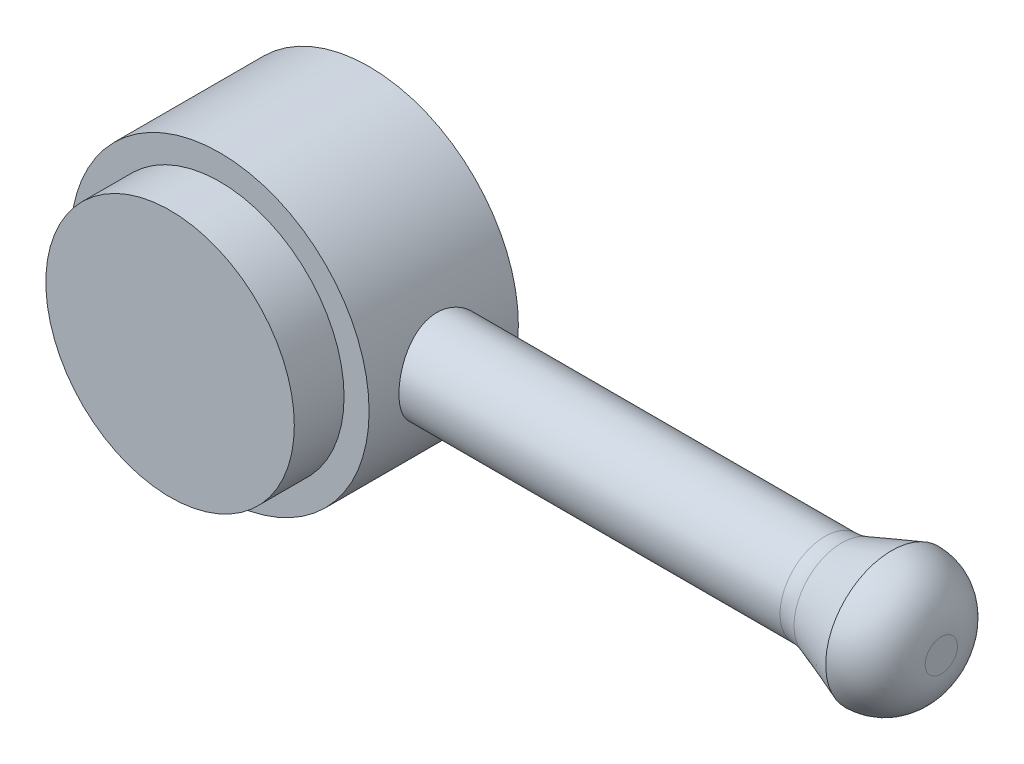
from build123d import *

# Parameters (mm, degrees)
SKETCH1_R           = 12.485
BOSS_EXTRUDE1_DEPTH = 20
SKETCH2_R           = 15
BOSS_EXTRUDE2_DEPTH = 15
SKETCH3_R           = 4.5
BOSS_EXTRUDE3_DEPTH = 55
SKETCH4_R           = 4.8
BOSS_EXTRUDE4_DEPTH = 5
BOSS_EXTRUDE4_DRAFT = -20
SKETCH5_R           = 6.619851171
BOSS_EXTRUDE6_DEPTH = 5
FILLET1_R           = 5
FILLET2_R           = 5
CUT_EXTRUDE2_START  = -15
SKETCH6_R           = 12.485
CUT_EXTRUDE2_DEPTH  = 15


# Some blends are built 0.0001 mm under size
with BuildPart() as part:
    # Sketch1 → Boss-Extrude1 (new body)
    with BuildSketch(Plane.XY):
        Circle(SKETCH1_R)
    extrude(amount=BOSS_EXTRUDE1_DEPTH)

    # Sketch2 → Boss-Extrude2 (add)
    with BuildSketch(Plane(origin=(0, 0, 0), x_dir=(-1, 0, 0), z_dir=(0, 0, -1))):
        Circle(SKETCH2_R)
    extrude(amount=BOSS_EXTRUDE2_DEPTH)

    # Sketch3 → Boss-Extrude3 (add)
    with BuildSketch(Plane(origin=(0, 0, 0), x_dir=(0, 0, -1), z_dir=(1, 0, 0))):
        with Locations((7.5, 0)):
            Circle(SKETCH3_R)
    extrude(amount=BOSS_EXTRUDE3_DEPTH)


with BuildPart() as boss_extrude4_tool:
    # Sketch4 → Boss-Extrude4 (with draft: the straight prism first)
    with BuildSketch(Plane(origin=(55, 0, 0), x_dir=(0, 0, -1), z_dir=(1, 0, 0))):
        with Locations((7.5, 0)):
            Circle(SKETCH4_R)
    extrude(amount=BOSS_EXTRUDE4_DEPTH)
    # Boss-Extrude4: the draft: its side faces are tilted about the plane it starts from
    boss_extrude4_sides = [boss_extrude4_tool.faces().sort_by_distance(p)[0] for p in [
        (57.5, 0, -2.7),
    ]]
    draft(boss_extrude4_sides, Plane(origin=(55, 0, 0), x_dir=(0, 0, -1), z_dir=(1, 0, 0)), BOSS_EXTRUDE4_DRAFT)


with BuildPart() as part_1:
    add(part.part)

    # Boss-Extrude4: add boss_extrude4_tool
    add(boss_extrude4_tool.part)

    # Sketch5 → Boss-Extrude6 (add)
    with BuildSketch(Plane(origin=(60, 0, 0), x_dir=(0, 0, -1), z_dir=(1, 0, 0))):
        with Locations((7.5, 0)):
            Circle(SKETCH5_R)
    extrude(amount=BOSS_EXTRUDE6_DEPTH)

    # Fillet1
    fillet1_edges = [part_1.edges().sort_by_distance(p)[0] for p in [
        (65, 0, -0.880148829),
    ]]
    fillet(fillet1_edges, radius=FILLET1_R - 0.0001)  # a hair under: the kernel refuses the full size

    # Fillet2
    # the kernel refuses this fillet: 5 mm, written as the material it adds along each edge
    with BuildSketch(Plane(origin=(55, 0, -7.5), x_dir=(0, 0, -1), z_dir=(0, -1, 0))) as fillet2_piece_1:
        with BuildLine():
            CenterArc((9.5, -1.705872211), FILLET2_R, 160.051556411, 19.948443589)
            Line((4.5, -1.705872211), (4.4, -1.705872211))
            Line((4.4, -1.705872211), (4.4, 0))
            Line((4.4, 0), (4.5, 0.1))
            ThreePointArc((4.5, 0.1), (4.65, 0.1), (4.706, 0.034117444))
            Line((4.706, 0.034117444), (4.8, 0))
        make_face()
    revolve(axis=Axis((55, 0, -7.5), (1, 0, 0)))

    # Sketch6 → Cut-Extrude2 (cut)
    with BuildSketch(Plane.XY.offset(20).offset(CUT_EXTRUDE2_START)):
        Circle(SKETCH6_R)
    extrude(amount=CUT_EXTRUDE2_DEPTH, mode=Mode.SUBTRACT)


solid = part_1.part
